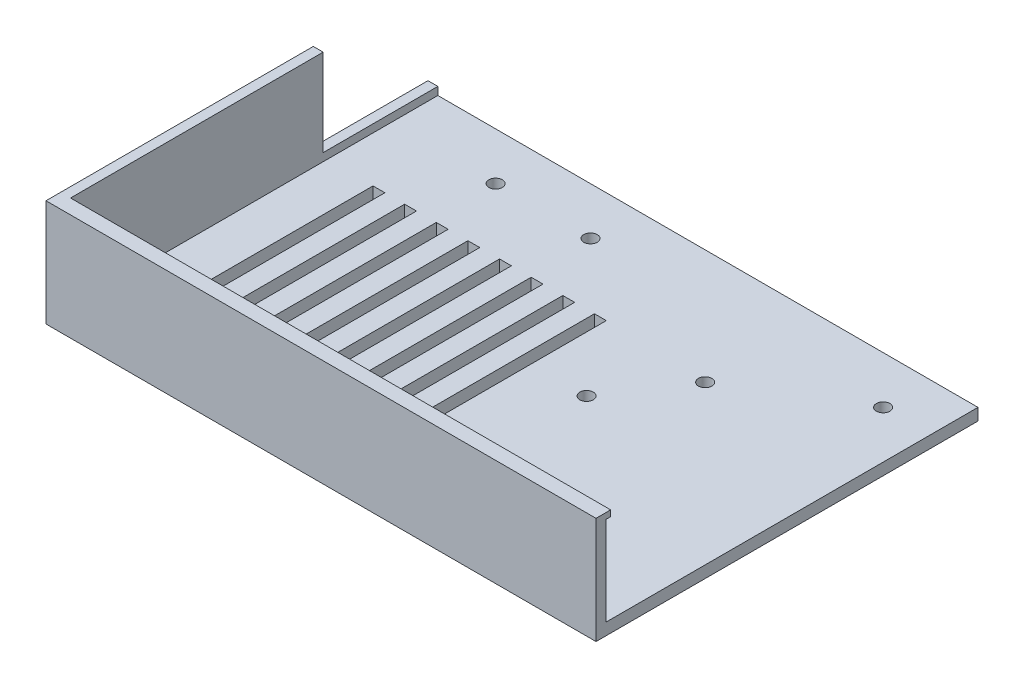
from build123d import *

# Parameters (mm, degrees)
SKETCH1_W                     = 278.2
SKETCH1_H                     = 193.2
SHELL_BLOCK_DEPTH             = 27
SKETCH2_W                     = 273.2
SKETCH2_H                     = 185.8
FRONT_OPENING_DEPTH           = 1.5
SKETCH3_W                     = 273.2
SKETCH3_H                     = 188.2
DISPLAY_POCKET_DEPTH          = 22.5
SKETCH4_W                     = 3
SKETCH4_H                     = 56
VENT_SLOTS_DEPTH              = 4
SKETCH5_W                     = 58
SKETCH5_H                     = 23
CABLE_EXIT_X_SHORT_SIDE_DEPTH = 140.1
SKETCH6_R                     = 1.7
BOLT_HOLES_DEPTH              = 4
KEEP_ONE_HALF_X_DEPTH         = 172.491603293
KEEP_ONE_HALF_X_DEPTH_BACK    = 172.491603293
SKETCH7_W                     = 200
SKETCH7_H                     = 400
KEEP_ONE_QUARTER_Z_DEPTH      = 172.491603293
KEEP_ONE_QUARTER_Z_DEPTH_BACK = 172.491603293
SKETCH8_W                     = 400
SKETCH8_H                     = 200


with BuildPart() as part:
    # Sketch1 → Shell Block (new body)
    with BuildSketch(Plane(origin=(0, 0, 0), x_dir=(1, 0, 0), z_dir=(0, 1, 0))):
        Rectangle(SKETCH1_W, SKETCH1_H)
    extrude(amount=SHELL_BLOCK_DEPTH)

    # Sketch2 → Front Opening (cut)
    with BuildSketch(Plane(origin=(0, 27, 0), x_dir=(1, 0, 0), z_dir=(0, 1, 0))):
        Rectangle(SKETCH2_W, SKETCH2_H)
    extrude(amount=-FRONT_OPENING_DEPTH, mode=Mode.SUBTRACT)

    # Sketch3 → Display Pocket (cut)
    with BuildSketch(Plane(origin=(0, 25.5, 0), x_dir=(1, 0, 0), z_dir=(0, 1, 0))):
        Rectangle(SKETCH3_W, SKETCH3_H)
    extrude(amount=-DISPLAY_POCKET_DEPTH, mode=Mode.SUBTRACT)

    # Sketch4 → Vent Slots (cut)
    with BuildSketch(Plane(origin=(0, 3, 0), x_dir=(1, 0, 0), z_dir=(0, 1, 0))):
        with Locations((-67.5, 56)):
            Rectangle(SKETCH4_W, SKETCH4_H)
        with Locations((-67.5, -56)):
            Rectangle(SKETCH4_W, SKETCH4_H)
        with Locations((-75.5, 56)):
            Rectangle(SKETCH4_W, SKETCH4_H)
        with Locations((-75.5, -56)):
            Rectangle(SKETCH4_W, SKETCH4_H)
        with Locations((-83.5, 56)):
            Rectangle(SKETCH4_W, SKETCH4_H)
        with Locations((-83.5, -56)):
            Rectangle(SKETCH4_W, SKETCH4_H)
        with Locations((-91.5, 56)):
            Rectangle(SKETCH4_W, SKETCH4_H)
        with Locations((-91.5, -56)):
            Rectangle(SKETCH4_W, SKETCH4_H)
        with Locations((-99.5, 56)):
            Rectangle(SKETCH4_W, SKETCH4_H)
        with Locations((-99.5, -56)):
            Rectangle(SKETCH4_W, SKETCH4_H)
        with Locations((-107.5, 56)):
            Rectangle(SKETCH4_W, SKETCH4_H)
        with Locations((-107.5, -56)):
            Rectangle(SKETCH4_W, SKETCH4_H)
        with Locations((-115.5, 56)):
            Rectangle(SKETCH4_W, SKETCH4_H)
        with Locations((-115.5, -56)):
            Rectangle(SKETCH4_W, SKETCH4_H)
        with Locations((-123.5, 56)):
            Rectangle(SKETCH4_W, SKETCH4_H)
        with Locations((-123.5, -56)):
            Rectangle(SKETCH4_W, SKETCH4_H)
    extrude(amount=-VENT_SLOTS_DEPTH, mode=Mode.SUBTRACT)

    # Sketch5 → Cable Exit (-X short side) (cut)
    with BuildSketch(Plane(origin=(0, 0, 0), x_dir=(0, 0, -1), z_dir=(1, 0, 0))):
        with Locations((0, 16.5)):
            Rectangle(SKETCH5_W, SKETCH5_H)
    extrude(amount=-CABLE_EXIT_X_SHORT_SIDE_DEPTH, mode=Mode.SUBTRACT)

    # Sketch6 → Bolt Holes (cut)
    with BuildSketch(Plane(origin=(0, 3, 0), x_dir=(1, 0, 0), z_dir=(0, 1, 0))):
        with Locations((-40, -29)):
            Circle(SKETCH6_R)
        with Locations((-40, -89)):
            Circle(SKETCH6_R)
        with Locations((40, -29)):
            Circle(SKETCH6_R)
        with Locations((40, -89)):
            Circle(SKETCH6_R)
        with Locations((-52, -47)):
            Circle(SKETCH6_R)
        with Locations((-52, -71)):
            Circle(SKETCH6_R)
        with Locations((52, -47)):
            Circle(SKETCH6_R)
        with Locations((52, -71)):
            Circle(SKETCH6_R)
        with Locations((-12, 82)):
            Circle(SKETCH6_R)
        with Locations((12, 82)):
            Circle(SKETCH6_R)
        with Locations((124, 12)):
            Circle(SKETCH6_R)
        with Locations((124, -12)):
            Circle(SKETCH6_R)
        with Locations((-12, 12)):
            Circle(SKETCH6_R)
        with Locations((-12, -12)):
            Circle(SKETCH6_R)
        with Locations((12, 12)):
            Circle(SKETCH6_R)
        with Locations((12, -12)):
            Circle(SKETCH6_R)
        with Locations((-110, -12)):
            Circle(SKETCH6_R)
        with Locations((-110, 12)):
            Circle(SKETCH6_R)
        with Locations((-86, -12)):
            Circle(SKETCH6_R)
        with Locations((-86, 12)):
            Circle(SKETCH6_R)
    extrude(amount=-BOLT_HOLES_DEPTH, mode=Mode.SUBTRACT)

    # Sketch7 → Keep one half (X) (cut, two sides: drawn at the far end of the back side and taken through both)
    with BuildSketch(Plane(origin=(0, 0, 0), x_dir=(1, 0, 0), z_dir=(0, 1, 0)).offset(-KEEP_ONE_HALF_X_DEPTH_BACK)):
        with Locations((100, 0)):
            Rectangle(SKETCH7_W, SKETCH7_H)
    extrude(amount=KEEP_ONE_HALF_X_DEPTH + KEEP_ONE_HALF_X_DEPTH_BACK, mode=Mode.SUBTRACT)

    # Sketch8 → Keep one quarter (Z) (cut, two sides: drawn at the far end of the back side and taken through both)
    with BuildSketch(Plane(origin=(0, 0, 0), x_dir=(1, 0, 0), z_dir=(0, 1, 0)).offset(-KEEP_ONE_QUARTER_Z_DEPTH_BACK)):
        with Locations((0, 100)):
            Rectangle(SKETCH8_W, SKETCH8_H)
    extrude(amount=KEEP_ONE_QUARTER_Z_DEPTH + KEEP_ONE_QUARTER_Z_DEPTH_BACK, mode=Mode.SUBTRACT)


solid = part.part
